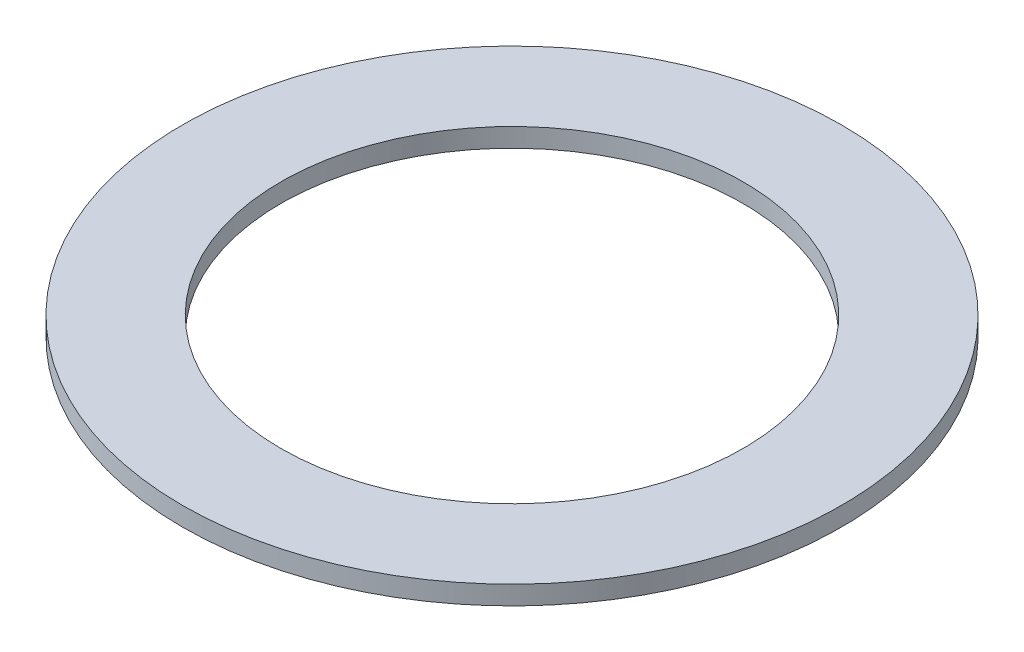
from build123d import *

# Parameters (mm, degrees)
SKETCH1_R           = 17.5
SKETCH1_R_2         = 12.27
BOSS_EXTRUDE1_DEPTH = 1


with BuildPart() as part:
    # Sketch1 → Boss-Extrude1 (new body)
    with BuildSketch(Plane(origin=(0, 0, 0), x_dir=(1, 0, 0), z_dir=(0, 1, 0))):
        Circle(SKETCH1_R)
        Circle(SKETCH1_R_2, mode=Mode.SUBTRACT)
    extrude(amount=BOSS_EXTRUDE1_DEPTH)


solid = part.part
